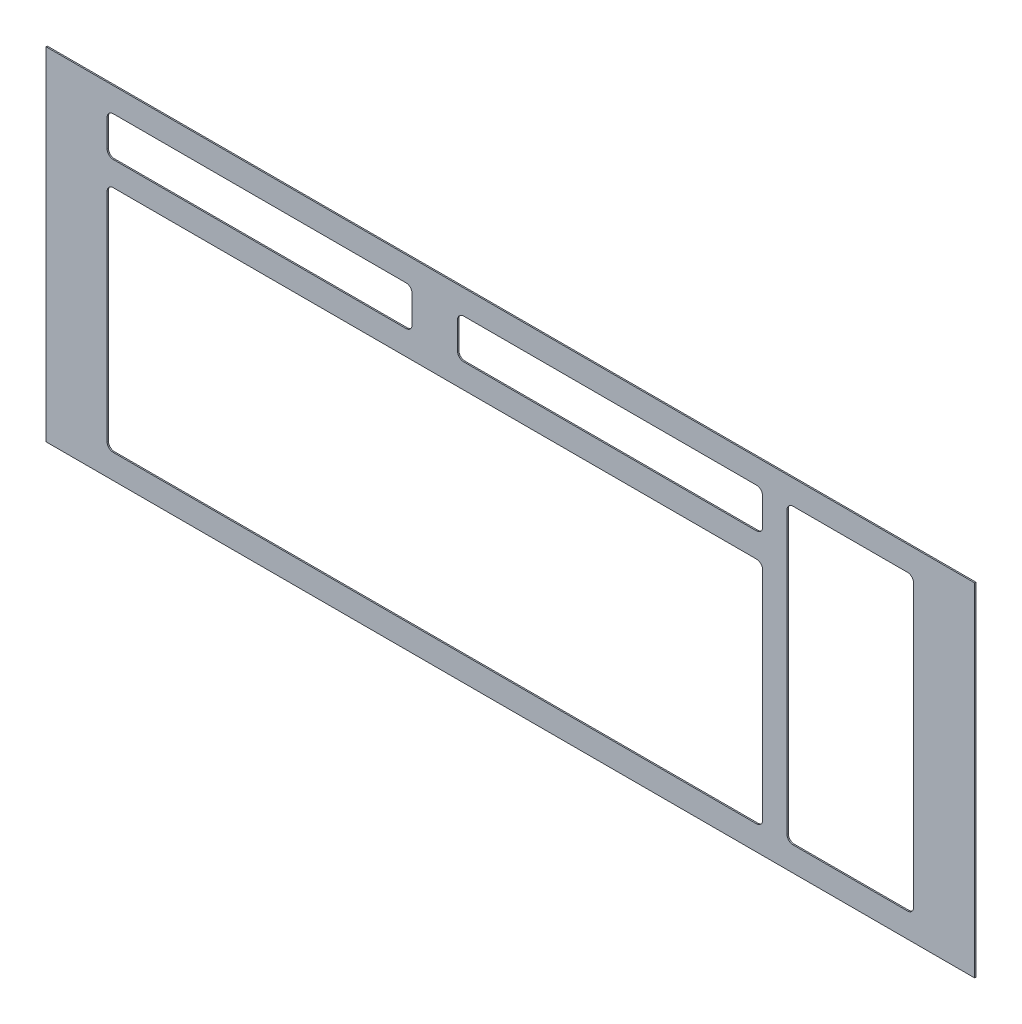
from build123d import *

# Parameters (mm, degrees)
SKETCH1_W          = 482.6
SKETCH1_H          = 177.8
BASE_FLANGE1_DEPTH = 0.6604
SKETCH2_W          = 158.496
SKETCH2_H          = 20.574
CUT_EXTRUDE1_DEPTH = 0.6604
LPATTERN1_COUNT    = 2
LPATTERN1_PITCH    = 182.118
SKETCH3_W          = 340.614
SKETCH3_H          = 119.126
CUT_EXTRUDE2_DEPTH = 0.6604
SKETCH4_W          = 65.786
SKETCH4_H          = 152.4
CUT_EXTRUDE3_DEPTH = 0.6604
FILLET1_R          = 3.175


# Sheet-metal steps are written as plain solids
with BuildPart() as part:
    # Sketch1 → Base-Flange1 (new body)
    with BuildSketch(Plane.XY):
        with Locations((189.940791832, 97.32180564)):
            Rectangle(SKETCH1_W, SKETCH1_H)
    extrude(amount=-BASE_FLANGE1_DEPTH)

    # Sketch2 → Cut-Extrude1 (cut)
    with BuildSketch(Plane.XY):
        with Locations((59.638791832, 163.23480564)):
            Rectangle(SKETCH2_W, SKETCH2_H)
    cut_extrude1 = extrude(amount=-CUT_EXTRUDE1_DEPTH, mode=Mode.SUBTRACT)

    # LPattern1: Cut-Extrude1 ×2
    with Locations(*[(i * LPATTERN1_PITCH, 0, 0) for i in range(1, LPATTERN1_COUNT)]):
        add(cut_extrude1, mode=Mode.SUBTRACT)

    # Sketch3 → Cut-Extrude2 (cut)
    with BuildSketch(Plane.XY):
        with Locations((150.697791832, 80.68480564)):
            Rectangle(SKETCH3_W, SKETCH3_H)
    extrude(amount=-CUT_EXTRUDE2_DEPTH, mode=Mode.SUBTRACT)

    # Sketch4 → Cut-Extrude3 (cut)
    with BuildSketch(Plane(origin=(0, 0, -0.6604), x_dir=(-1, 0, 0), z_dir=(0, 0, -1))):
        with Locations((-366.597791832, 97.32180564)):
            Rectangle(SKETCH4_W, SKETCH4_H)
    extrude(amount=-CUT_EXTRUDE3_DEPTH, mode=Mode.SUBTRACT)

    # Fillet1
    fillet1_edges = [part.edges().sort_by_distance(p)[0] for p in [
        (-19.609208168, 152.94780564, -0.3302),
        (-19.609208168, 173.52180564, -0.3302),
        (138.886791832, 173.52180564, -0.3302),
        (138.886791832, 152.94780564, -0.3302),
        (162.508791832, 152.94780564, -0.3302),
        (162.508791832, 173.52180564, -0.3302),
        (321.004791832, 173.52180564, -0.3302),
        (321.004791832, 152.94780564, -0.3302),
        (-19.609208168, 21.12180564, -0.3302),
        (-19.609208168, 140.24780564, -0.3302),
        (321.004791832, 140.24780564, -0.3302),
        (321.004791832, 21.12180564, -0.3302),
        (399.490791832, 21.12180564, -0.3302),
        (399.490791832, 173.52180564, -0.3302),
        (333.704791832, 173.52180564, -0.3302),
        (333.704791832, 21.12180564, -0.3302),
    ]]
    fillet(fillet1_edges, radius=FILLET1_R)


solid = part.part
